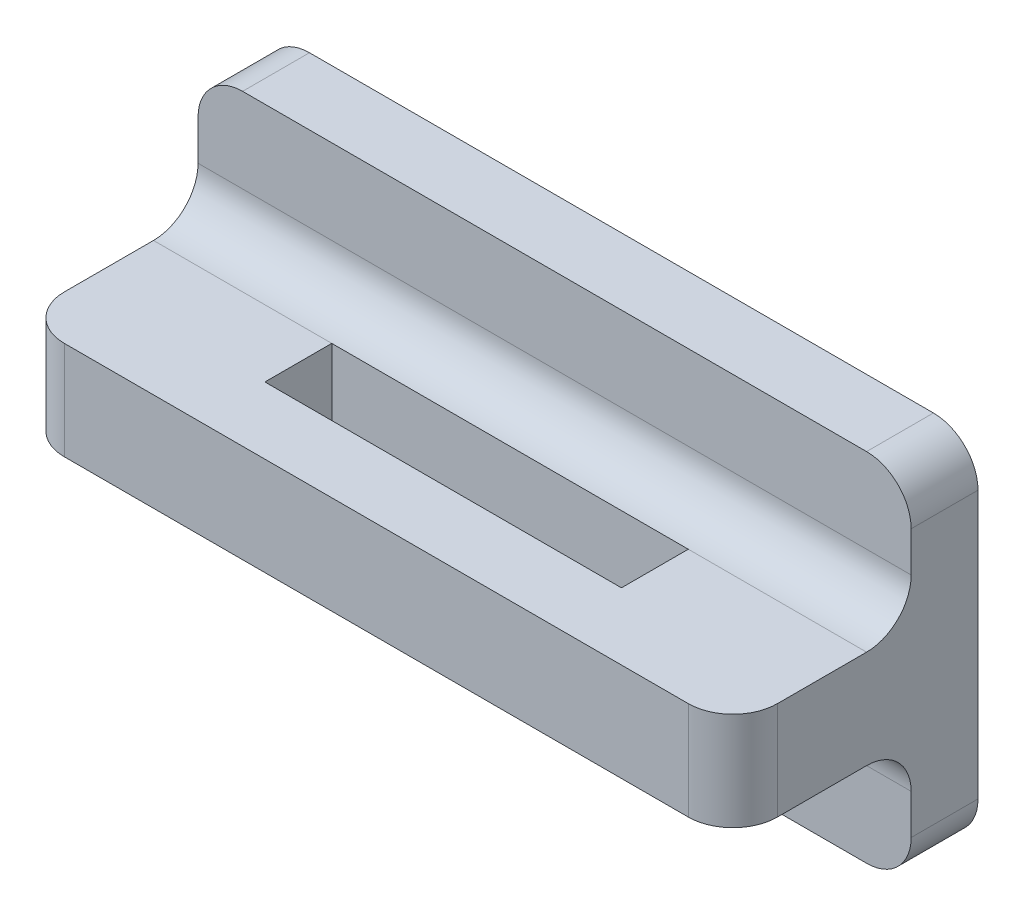
from build123d import *

# Parameters (mm, degrees)
SKETCH1_W           = 50.8
SKETCH1_H           = 25.4
BOSS_EXTRUDE1_DEPTH = 4.7625
SKETCH2_W           = 50.8
SKETCH2_H           = 7
BOSS_EXTRUDE2_DEPTH = 12.7
FILLET1_R           = 3.175
SKETCH3_W           = 25.4
SKETCH3_H           = 4.7625
CUT_EXTRUDE1_DEPTH  = 35.82152935


with BuildPart() as part:
    # Sketch1 → Boss-Extrude1 (new body)
    with BuildSketch(Plane.XY):
        Rectangle(SKETCH1_W, SKETCH1_H)
    extrude(amount=BOSS_EXTRUDE1_DEPTH)

    # Sketch2 → Boss-Extrude2 (add)
    with BuildSketch(Plane.XY.offset(4.7625)):
        Rectangle(SKETCH2_W, SKETCH2_H)
    extrude(amount=BOSS_EXTRUDE2_DEPTH)

    # Fillet1
    fillet1_edges = [part.edges().sort_by_distance(p)[0] for p in [
        (0, 3.5, 4.7625),
        (0, -3.5, 4.7625),
        (-25.4, 0, 17.4625),
        (25.4, 0, 17.4625),
        (25.4, 12.7, 2.38125),
        (25.4, -12.7, 2.38125),
        (-25.4, 12.7, 2.38125),
        (-25.4, -12.7, 2.38125),
    ]]
    fillet(fillet1_edges, radius=FILLET1_R)

    # Sketch3 → Cut-Extrude1 (cut, through all)
    with BuildSketch(Plane.XZ.offset(3.5)):
        with Locations((0, 10.31875)):
            Rectangle(SKETCH3_W, SKETCH3_H)
    extrude(amount=-CUT_EXTRUDE1_DEPTH, mode=Mode.SUBTRACT)


solid = part.part
